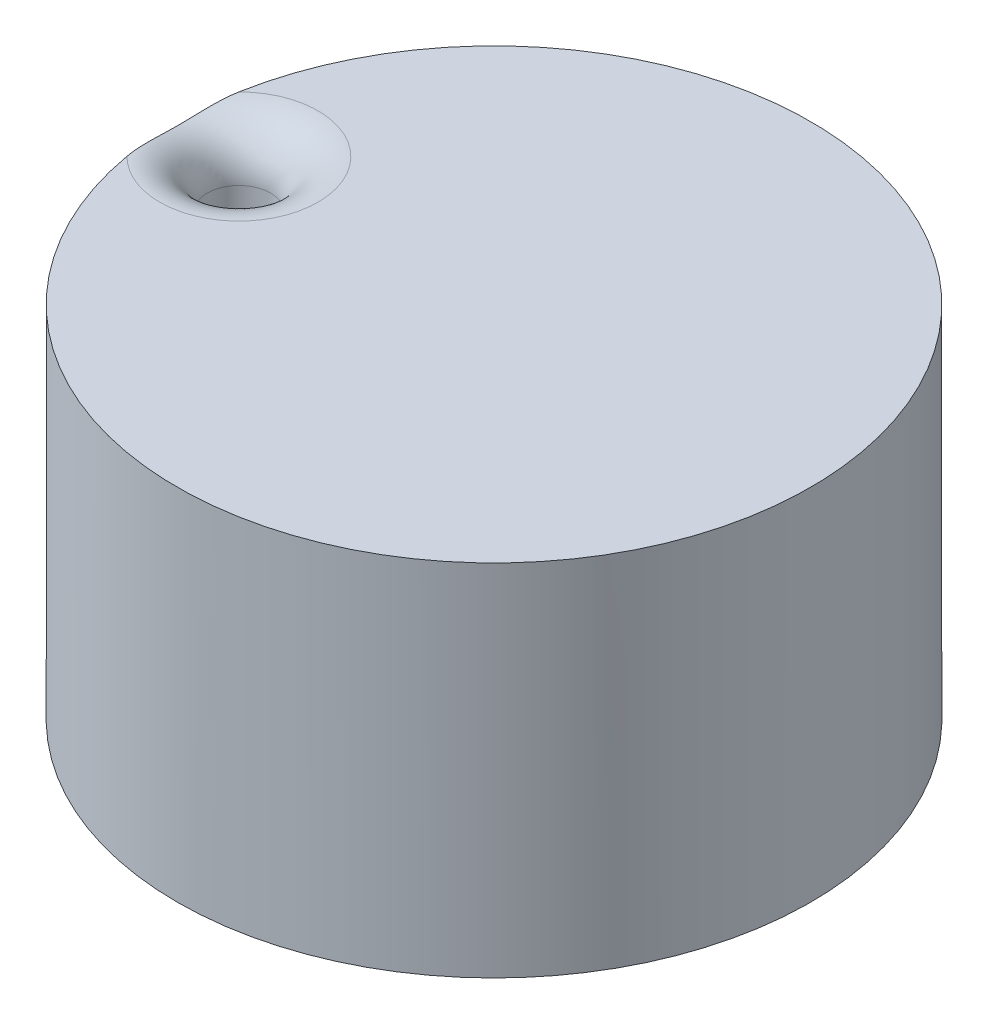
from build123d import *

# Parameters (mm, degrees)
SKETCH2_R           = 50.8
BOSS_EXTRUDE1_DEPTH = 57.658
SKETCH3_R           = 5.08
CUT_EXTRUDE1_DEPTH  = 57.658
FILLET1_R           = 7.62


with BuildPart() as part:
    # Sketch2 → Boss-Extrude1 (new body)
    with BuildSketch(Plane(origin=(0, 0, 0), x_dir=(1, 0, 0), z_dir=(0, 1, 0))):
        with Locations(Location((0, 0, 0), (0, 0, 90))):
            Circle(SKETCH2_R)
    extrude(amount=BOSS_EXTRUDE1_DEPTH)

    # Sketch3 → Cut-Extrude1 (cut)
    with BuildSketch(Plane(origin=(0, 57.658, 0), x_dir=(1, 0, 0), z_dir=(0, 1, 0))):
        with Locations(Location((-41.011760438, 0.088591559, 0), (0, 0, 270))):
            Circle(SKETCH3_R)
    extrude(amount=-CUT_EXTRUDE1_DEPTH, mode=Mode.SUBTRACT)

    # Fillet1
    # the kernel refuses this fillet: 7.62 mm, written as the material it takes off along each edge
    with BuildSketch(Plane(origin=(-41.011760438, 57.658, -0.088591559), x_dir=(0, 0, 1), z_dir=(-1, 0, 0))) as fillet1_piece_1:
        with BuildLine():
            CenterArc((5.08 + FILLET1_R, -FILLET1_R), FILLET1_R, 90, 90)
            Line((5.08, -FILLET1_R), (5.08, 0))
            Line((5.08, 0), (5.08 + FILLET1_R, 0))
        make_face()
    revolve(axis=Axis((-41.011760438, 57.658, -0.088591559), (0, 1, 0)), mode=Mode.SUBTRACT)


solid = part.part
